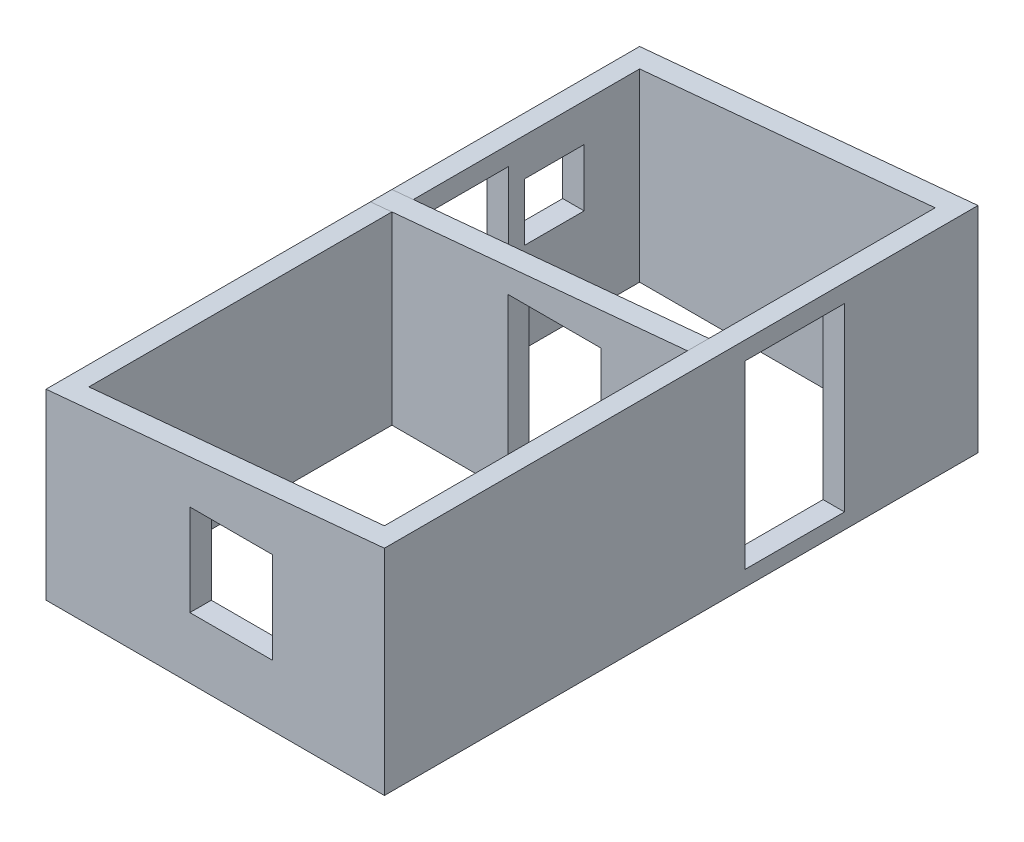
from build123d import *

# Parameters (mm, degrees)
EXTRUDE_1_OUTLINE_W   = 3160
EXTRUDE_1_OUTLINE_H   = 5543
EXTRUDE_1_OUTLINE_W_2 = 2760
EXTRUDE_1_OUTLINE_H_2 = 5143
EXTRUDE_1_DEPTH       = 2000
EXTRUDE_1_2_OUTLINE_W = 3160
EXTRUDE_1_2_OUTLINE_H = 200
EXTRUDE_1_2_DEPTH     = 2000
CUT_EXTRUDE_1_DEPTH   = 6687.587246122
SKETCH_3_W            = 558.75449328
SKETCH_3_H            = 536.842552368
SKETCH_3_W_2          = 805.263828551
SKETCH_3_H_2          = 1547.369391924
CUT_EXTRUDE_2_DEPTH   = 200
SKETCH_4_W            = 772.237717919
SKETCH_4_H            = 854.245263185
CUT_EXTRUDE_3_DEPTH   = 200
SKETCH_5_W            = 870.964551477
SKETCH_5_H            = 1599.759628709
CUT_EXTRUDE_4_DEPTH   = 200
SKETCH_6_W            = 930.561753535
SKETCH_6_H            = 1685.729668706
CUT_EXTRUDE_5_DEPTH   = 200


# Read off the part's stored shape, not the designer's step: Вытянуть-Тонкостенный1
with BuildPart() as part:
    # Вытянуть-Тонкостенный1 outline → Вытянуть-Тонкостенный1 (new body)
    with BuildSketch(Plane(origin=(0, 0, 0), x_dir=(1, 0, 0), z_dir=(0, 1, 0))):
        with Locations((1580, 2771.5)):
            Rectangle(EXTRUDE_1_OUTLINE_W, EXTRUDE_1_OUTLINE_H)
        with Locations((1580, 2771.5)):
            Rectangle(EXTRUDE_1_OUTLINE_W_2, EXTRUDE_1_OUTLINE_H_2, mode=Mode.SUBTRACT)
    extrude(amount=EXTRUDE_1_DEPTH)


with BuildPart() as body_2:
    # Extrude 1 2 outline → Extrude 1 2 (new body)
    with BuildSketch(Plane(origin=(0, 0, 0), x_dir=(1, 0, 0), z_dir=(0, 1, 0))):
        with Locations((1580, 3129.997484617)):
            Rectangle(EXTRUDE_1_2_OUTLINE_W, EXTRUDE_1_2_OUTLINE_H)
    extrude(amount=EXTRUDE_1_2_DEPTH)


with BuildPart() as cut_extrude_1_tool:
    # Эскиз2 → Вырез-Вытянуть1 (new, through all)
    with BuildSketch(Plane.XY):
        Polygon((0, 2000), (3160, 2000), (0, 1706.10063383), align=None)
    extrude(amount=-CUT_EXTRUDE_1_DEPTH)


with BuildPart() as part_1:
    add(part.part)

    # Вырез-Вытянуть1: cut by cut_extrude_1_tool
    add(cut_extrude_1_tool.part, mode=Mode.SUBTRACT)

    # Эскиз3 → Вырез-Вытянуть2 (cut)
    with BuildSketch(Plane.ZY):
        with Locations((-4545.769607678, 1103.652588436)):
            Rectangle(SKETCH_3_W, SKETCH_3_H)
        with Locations((-3715.8548456, 773.684695962)):
            Rectangle(SKETCH_3_W_2, SKETCH_3_H_2)
    extrude(amount=-CUT_EXTRUDE_2_DEPTH, mode=Mode.SUBTRACT)

    # Эскиз4 → Вырез-Вытянуть3 (cut)
    with BuildSketch(Plane.XY):
        with Locations((1729.734220459, 998.277334586)):
            Rectangle(SKETCH_4_W, SKETCH_4_H)
    extrude(amount=-CUT_EXTRUDE_3_DEPTH, mode=Mode.SUBTRACT)

    # Эскиз6 → Вырез-Вытянуть5 (cut)
    with BuildSketch(Plane(origin=(3160, 0, 0), x_dir=(0, 0, -1), z_dir=(1, 0, 0))):
        with Locations((3831.171106774, 987.819872336)):
            Rectangle(SKETCH_6_W, SKETCH_6_H)
    extrude(amount=-CUT_EXTRUDE_5_DEPTH, mode=Mode.SUBTRACT)


with BuildPart() as body_2_1:
    add(body_2.part)

    # Вырез-Вытянуть1: cut by cut_extrude_1_tool
    add(cut_extrude_1_tool.part, mode=Mode.SUBTRACT)

    # Эскиз5 → Вырез-Вытянуть4 (cut)
    with BuildSketch(Plane.XY.offset(-3029.997484617)):
        with Locations((1717.874921169, 799.879814355)):
            Rectangle(SKETCH_5_W, SKETCH_5_H)
    extrude(amount=-CUT_EXTRUDE_4_DEPTH, mode=Mode.SUBTRACT)


solid = Compound([part_1.part, body_2_1.part])
